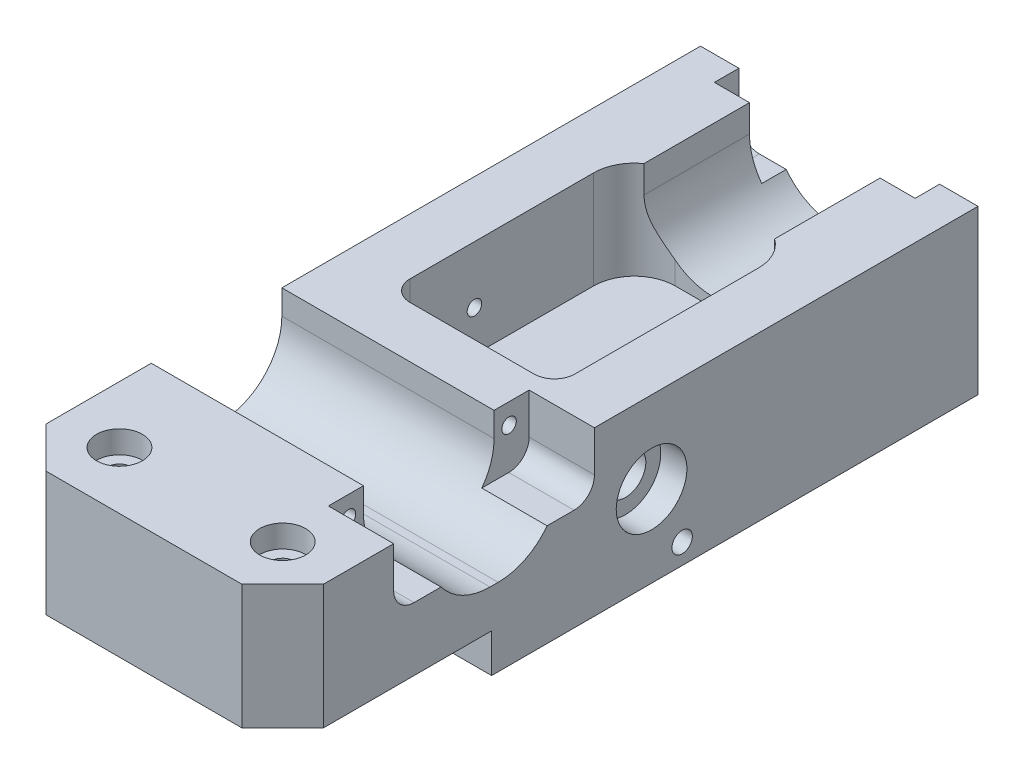
from build123d import *

# Parameters (mm, degrees)
BASE_DEPTH                    = 12.7
BASE_DEPTH_BACK               = 12.7
SKETCH1_W                     = 43.18
SKETCH1_H                     = 108.204
ACTUATORPLANECUT_DEPTH        = 6.0325
CENTERSLOT_DEPTH              = 60.619162222
CENTERSLOT_DEPTH_BACK         = 60.619162222
SKETCH5_W                     = 25.654
SKETCH5_H                     = 12.7
SHAFTGUIDE_REACH              = 113.065
SKETCH2_R                     = 4.7625
CENTERSLOTFILLET_R            = 3.175
GEARBOXPIT_DEPTH              = 11.176
FRONTCUTAWAY_DEPTH            = 15.24
GEARBOXSLOTSH_DEPTH           = 2.286
SKETCH55_R                    = 1.5875
GUIDEBARHOLE_DEPTH            = 71.376336961
PITCHSHAFTHOLE_DEPTH          = 60.619162279
PITCHSHAFTHOLE_DEPTH_BACK     = 60.619162279
SKETCH56_R                    = 3.175
SKETCH57_R                    = 5.5
BEARINGBORER_DEPTH            = 4.064
TOGGLEASSEMHOLES_D            = 2.7051
TOGGLEASSEMHOLES_DEPTH        = 9.398
TOGGLEASSEMHOLES_TIP          = 0.81269403
BACKCHAMFERS_SIZE             = 6.35
PITCHMOTORSLOT_DEPTH          = 71.37633704
PITCHMOTORMOUNTINGSLOTS_DEPTH = 10.16
PITCHMOTORMOUNTINGHOLES_D     = 2.2606
PITCHMOTORMOUNTINGHOLES_DEPTH = 7.5946
PITCHMOTORMOUNTINGHOLES_TIP   = 0.679152758
GEARBOXMOUNTINGHOLES_D        = 2.7051
GEARBOXMOUNTINGHOLES_DEPTH    = 9.398
GEARBOXMOUNTINGHOLES_TIP      = 0.81269403
CAPMOUNTINGHOLES_D            = 3.6576
CAPMOUNTINGHOLES_CBORE_D      = 7.14502
CAPMOUNTINGHOLES_CBORE_DEPTH  = 3.5052
ENCODERMOUNTINGHOLES_D        = 2.2606
ENCODERMOUNTINGHOLES_DEPTH    = 10.1346
ENCODERMOUNTINGHOLES_TIP      = 0.679152758
ROLLMOTORSLOT_REACH           = 113.065
ROLLMOTORMOUNTINGSLOTS_DEPTH  = 3.81
ROLLMOTORMOUNTINGHOLES_D      = 2.2606
ROLLMOTORMOUNTINGHOLES_DEPTH  = 7.62
ROLLMOTORMOUNTINGHOLES_TIP    = 0.679152758


with BuildPart() as part:
    # Sketch1 → Base (new, two sides: drawn at the far end of the back side and taken through both)
    with BuildSketch(Plane(origin=(0, 0, 0), x_dir=(1, 0, 0), z_dir=(0, 1, 0)).offset(-BASE_DEPTH_BACK)):
        Rectangle(SKETCH1_W, SKETCH1_H)
    extrude(amount=BASE_DEPTH + BASE_DEPTH_BACK)

    # Sketch3 → ActuatorPlaneCut (cut)
    with BuildSketch(Plane(origin=(0, -12.7, 0), x_dir=(-1, 0, 0), z_dir=(0, -1, 0))):
        Polygon((10.922, -21.59), (16.256, -21.59), (21.59, -21.59), (21.59, -54.102), (-21.59, -54.102), (-21.59, -21.59), (-10.922, -21.59), (-10.922, -4.826), (10.922, -4.826), align=None)
    extrude(amount=-ACTUATORPLANECUT_DEPTH, mode=Mode.SUBTRACT)

    # Sketch5 → CenterSlot (cut, two sides: drawn at the far end of the back side and taken through both)
    with BuildSketch(Plane(origin=(0, 0, 0), x_dir=(1, 0, 0), z_dir=(0, 1, 0)).offset(-CENTERSLOT_DEPTH_BACK)):
        with Locations((0, 3.302)):
            Rectangle(SKETCH5_W, SKETCH5_H)
    extrude(amount=CENTERSLOT_DEPTH + CENTERSLOT_DEPTH_BACK, mode=Mode.SUBTRACT)

    # Sketch2 → ShaftGuide (cut, up to next)
    with BuildSketch(Plane(origin=(0, 0, -54.102), x_dir=(-1, 0, 0), z_dir=(0, 0, -1)), mode=Mode.PRIVATE) as shaftguide_sk1:
        with Locations((0, -12.7)):
            Circle(SKETCH2_R)
    shaftguide_tool1 = extrude(shaftguide_sk1.sketch, amount=-SHAFTGUIDE_REACH, mode=Mode.PRIVATE) & part.part
    add(shaftguide_tool1.solids().sort_by_distance((0, -12.7, -54.102))[0], mode=Mode.SUBTRACT)

    # CenterSlotFillet
    centerslotfillet_edges = [part.edges().sort_by_distance(p)[0] for p in [
        (-12.827, 0, -9.652),
        (-12.827, 0, 3.048),
        (12.827, 0, 3.048),
        (12.827, 0, -9.652),
    ]]
    fillet(centerslotfillet_edges, radius=CENTERSLOTFILLET_R)

    # Sketch40 → GearBoxPit (cut)
    with BuildSketch(Plane.XZ.offset(12.7)):
        with BuildLine():
            Line((10.922, 0.508), (-10.922, 0.508))
            Line((-10.922, 0.508), (-10.922, 18.415))
            ThreePointArc((-10.922, 18.415), (-9.99206403, 20.66006403), (-7.747, 21.59))
            Line((-7.747, 21.59), (7.747, 21.59))
            ThreePointArc((7.747, 21.59), (9.99206403, 20.66006403), (10.922, 18.415))
            Line((10.922, 18.415), (10.922, 0.508))
        make_face()
    extrude(amount=-GEARBOXPIT_DEPTH, mode=Mode.SUBTRACT)

    # Sketch60 → FrontCutaway (cut)
    with BuildSketch(Plane(origin=(0, 12.7, 0), x_dir=(1, 0, 0), z_dir=(0, 1, 0))):
        with BuildLine():
            Line((-12.827, 6.477), (12.827, 6.477))
            Line((12.827, 6.477), (12.827, 28.702))
            ThreePointArc((12.827, 28.702), (10.967128061, 33.192128061), (6.477, 35.052))
            Line((6.477, 35.052), (-6.477, 35.052))
            ThreePointArc((-6.477, 35.052), (-10.967128061, 33.192128061), (-12.827, 28.702))
            Line((-12.827, 28.702), (-12.827, 6.477))
        make_face()
    extrude(amount=-FRONTCUTAWAY_DEPTH, mode=Mode.SUBTRACT)

    # Sketch67 → GearBoxSlotsH (cut)
    with BuildSketch(Plane(origin=(0, -12.7, 0), x_dir=(-1, 0, 0), z_dir=(0, -1, 0))):
        with BuildLine():
            Line((-12.3825, -6.461125), (12.3825, -6.461125))
            ThreePointArc((12.3825, -6.461125), (12.779375, -6.858), (12.3825, -7.254875))
            Line((12.3825, -7.254875), (-12.3825, -7.254875))
            ThreePointArc((-12.3825, -7.254875), (-12.779375, -6.858), (-12.3825, -6.461125))
        make_face()
        with BuildLine():
            Line((-12.3825, -17.129125), (12.3825, -17.129125))
            ThreePointArc((12.3825, -17.129125), (12.779375, -17.526), (12.3825, -17.922875))
            Line((12.3825, -17.922875), (-12.3825, -17.922875))
            ThreePointArc((-12.3825, -17.922875), (-12.779375, -17.526), (-12.3825, -17.129125))
        make_face()
    extrude(amount=-GEARBOXSLOTSH_DEPTH, mode=Mode.SUBTRACT)

    # Sketch55 → GuideBarHole (cut, through all)
    with BuildSketch(Plane.ZY.offset(21.59)):
        with Locations((-8.0645, -9.525)):
            Circle(SKETCH55_R)
    extrude(amount=-GUIDEBARHOLE_DEPTH, mode=Mode.SUBTRACT)

    # Sketch56 → PitchShaftHole (cut, two sides: drawn at the far end of the back side and taken through both)
    with BuildSketch(Plane(origin=(0, 0, 0), x_dir=(0, 0, -1), z_dir=(1, 0, 0)).offset(-PITCHSHAFTHOLE_DEPTH_BACK)):
        with Locations((3.302, 0)):
            Circle(SKETCH56_R)
    extrude(amount=PITCHSHAFTHOLE_DEPTH + PITCHSHAFTHOLE_DEPTH_BACK, mode=Mode.SUBTRACT)

    # Sketch57 → BearingBoreR (cut)
    with BuildSketch(Plane.ZY.offset(21.59)):
        with Locations((-3.302, 0)):
            Circle(SKETCH57_R)
    bearingborer = extrude(amount=-BEARINGBORER_DEPTH, mode=Mode.SUBTRACT)

    # BearingBoreL: BearingBoreR across plane
    add(bearingborer.mirror(Plane(origin=(0, 0, 0), x_dir=(0, 0, 1), z_dir=(1, 0, 0))), mode=Mode.SUBTRACT)

    # ToggleAssemHoles
    with Locations(Plane(origin=(0, -12.7, 0), x_dir=(-1, 0, 0), z_dir=(0, -1, 0))):
        with Locations((15.875, 22.352), (-15.875, 22.352)):
            Hole(TOGGLEASSEMHOLES_D / 2, depth=TOGGLEASSEMHOLES_DEPTH)
            with Locations((0, 0, -(TOGGLEASSEMHOLES_DEPTH + TOGGLEASSEMHOLES_TIP / 2))):  # 118° drill point
                Cone(0, TOGGLEASSEMHOLES_D / 2, TOGGLEASSEMHOLES_TIP, mode=Mode.SUBTRACT)

    # BackChamfers
    backchamfers_edges = [part.edges().sort_by_distance(p)[0] for p in [
        (21.59, 3.01625, 54.102),
        (-21.59, 3.01625, 54.102),
    ]]
    chamfer(backchamfers_edges, length=BACKCHAMFERS_SIZE)

    # Sketch62 → PitchMotorSlot (cut, through all)
    with BuildSketch(Plane.ZY.offset(21.59)):
        with BuildLine():
            Line((11.049, 9.525), (11.049, 12.7))
            Line((11.049, 12.7), (31.369, 12.7))
            Line((31.369, 12.7), (31.369, 9.525))
            Line((31.369, 9.525), (31.369, 8.89))
            ThreePointArc((31.369, 8.89), (28.579192091, 2.154807909), (21.844, -0.635))
            Line((21.844, -0.635), (20.574, -0.635))
            ThreePointArc((20.574, -0.635), (13.838807909, 2.154807909), (11.049, 8.89))
            Line((11.049, 8.89), (11.049, 9.525))
        make_face()
    extrude(amount=-PITCHMOTORSLOT_DEPTH, mode=Mode.SUBTRACT)

    # Sketch63 → PitchMotorMountingSlots (cut)
    with BuildSketch(Plane.ZY.offset(-21.59)):
        with BuildLine():
            Line((5.588, 12.7), (36.83, 12.7))
            Line((36.83, 12.7), (36.83, 6.35))
            ThreePointArc((36.83, 6.35), (35.90006403, 4.10493597), (33.655, 3.175))
            Line((33.655, 3.175), (8.763, 3.175))
            ThreePointArc((8.763, 3.175), (6.51793597, 4.10493597), (5.588, 6.35))
            Line((5.588, 6.35), (5.588, 12.7))
        make_face()
    extrude(amount=PITCHMOTORMOUNTINGSLOTS_DEPTH, mode=Mode.SUBTRACT)

    # PitchMotorMountingHoles
    with Locations(Plane(origin=(11.43, 0, 0), x_dir=(0, 0, -1), z_dir=(1, 0, 0))):
        with Locations((-33.7058, 9.525), (-8.7122, 9.525)):
            Hole(PITCHMOTORMOUNTINGHOLES_D / 2, depth=PITCHMOTORMOUNTINGHOLES_DEPTH)
            with Locations((0, 0, -(PITCHMOTORMOUNTINGHOLES_DEPTH + PITCHMOTORMOUNTINGHOLES_TIP / 2))):  # 118° drill point
                Cone(0, PITCHMOTORMOUNTINGHOLES_D / 2, PITCHMOTORMOUNTINGHOLES_TIP, mode=Mode.SUBTRACT)

    # GearBoxMountingHoles
    with Locations(Plane(origin=(0, -12.7, 0), x_dir=(-1, 0, 0), z_dir=(0, -1, 0))):
        with Locations((-16.256, -12.192), (16.256, -12.192)):
            Hole(GEARBOXMOUNTINGHOLES_D / 2, depth=GEARBOXMOUNTINGHOLES_DEPTH)
            with Locations((0, 0, -(GEARBOXMOUNTINGHOLES_DEPTH + GEARBOXMOUNTINGHOLES_TIP / 2))):  # 118° drill point
                Cone(0, GEARBOXMOUNTINGHOLES_D / 2, GEARBOXMOUNTINGHOLES_TIP, mode=Mode.SUBTRACT)

    # CapMountingHoles (through all)
    with Locations(Plane(origin=(-0.837932951, 12.7, 8.633720573), x_dir=(-1, 0, 0), z_dir=(0, 1, 0))):
        with Locations((-13.537932951, 36.578279427), (11.862067049, 36.578279427)):
            CounterBoreHole(CAPMOUNTINGHOLES_D / 2, CAPMOUNTINGHOLES_CBORE_D / 2, CAPMOUNTINGHOLES_CBORE_DEPTH)

    # EncoderMountingHoles
    with Locations(Plane.ZY.offset(21.59)):
        with Locations((3.556, 3.81), (-10.16, 3.81)):
            Hole(ENCODERMOUNTINGHOLES_D / 2, depth=ENCODERMOUNTINGHOLES_DEPTH)
            with Locations((0, 0, -(ENCODERMOUNTINGHOLES_DEPTH + ENCODERMOUNTINGHOLES_TIP / 2))):  # 118° drill point
                Cone(0, ENCODERMOUNTINGHOLES_D / 2, ENCODERMOUNTINGHOLES_TIP, mode=Mode.SUBTRACT)

    # Sketch81 → RollMotorSlot (cut, up to next)
    with BuildSketch(Plane(origin=(0, 0, -54.102), x_dir=(-1, 0, 0), z_dir=(0, 0, -1)), mode=Mode.PRIVATE) as rollmotorslot_sk1:
        with BuildLine():
            Line((10.16, 12.7), (-10.16, 12.7))
            Line((-10.16, 12.7), (-10.16, 8.46582))
            ThreePointArc((-10.16, 8.46582), (-7.370192091, 1.730627909), (-0.635, -1.05918))
            Line((-0.635, -1.05918), (0.635, -1.05918))
            ThreePointArc((0.635, -1.05918), (7.370192091, 1.730627909), (10.16, 8.46582))
            Line((10.16, 8.46582), (10.16, 12.7))
        make_face()
    rollmotorslot_tool1 = extrude(rollmotorslot_sk1.sketch, amount=-ROLLMOTORSLOT_REACH, mode=Mode.PRIVATE) & part.part
    add(rollmotorslot_tool1.solids().sort_by_distance((0, 6.589347, -54.102))[0], mode=Mode.SUBTRACT)

    # Sketch84 → RollMotorMountingSlots (cut)
    with BuildSketch(Plane(origin=(0, 0, -54.102), x_dir=(-1, 0, 0), z_dir=(0, 0, -1))):
        with BuildLine():
            Line((15.621, 12.7), (-15.621, 12.7))
            Line((-15.621, 12.7), (-15.621, 5.92582))
            ThreePointArc((-15.621, 5.92582), (-14.69106403, 3.68075597), (-12.446, 2.75082))
            Line((-12.446, 2.75082), (12.446, 2.75082))
            ThreePointArc((12.446, 2.75082), (14.69106403, 3.68075597), (15.621, 5.92582))
            Line((15.621, 5.92582), (15.621, 12.7))
        make_face()
    extrude(amount=-ROLLMOTORMOUNTINGSLOTS_DEPTH, mode=Mode.SUBTRACT)

    # RollMotorMountingHoles
    with Locations(Plane(origin=(0, 0, -50.292), x_dir=(-1, 0, 0), z_dir=(0, 0, -1))):
        with Locations((12.5, 8.46582), (-12.5, 8.46582)):
            Hole(ROLLMOTORMOUNTINGHOLES_D / 2, depth=ROLLMOTORMOUNTINGHOLES_DEPTH)
            with Locations((0, 0, -(ROLLMOTORMOUNTINGHOLES_DEPTH + ROLLMOTORMOUNTINGHOLES_TIP / 2))):  # 118° drill point
                Cone(0, ROLLMOTORMOUNTINGHOLES_D / 2, ROLLMOTORMOUNTINGHOLES_TIP, mode=Mode.SUBTRACT)


solid = part.part
